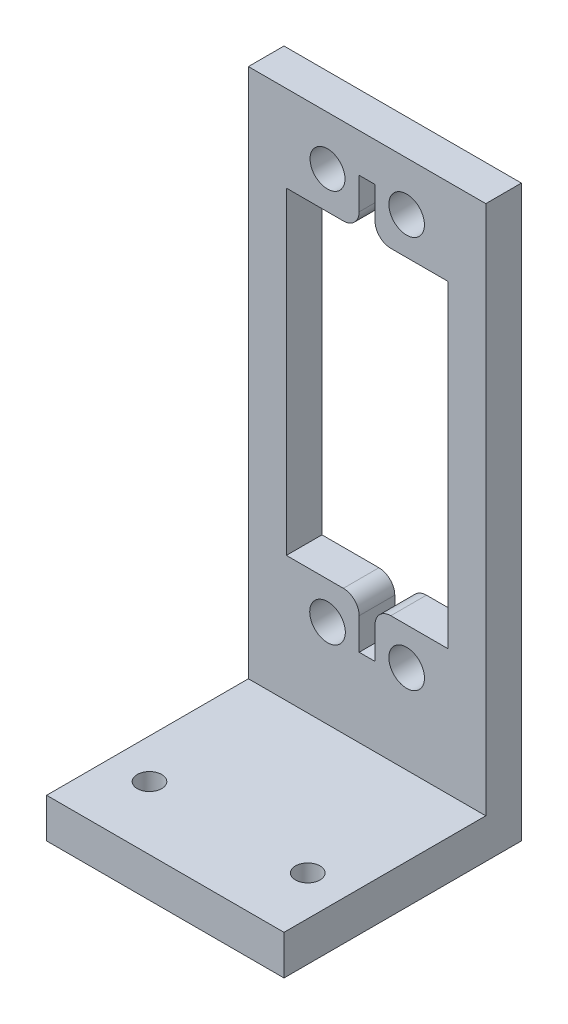
from build123d import *

# Parameters (mm, degrees)
SKETCH_1_W          = 30
SKETCH_1_H          = 62
SKETCH_1_W_2        = 20.4
SKETCH_1_H_2        = 40.2
EXTRUDE_1_DEPTH     = 4.5
SKETCH_3_R          = 2.25
SKETCH_3_R_2        = 2.20649786
CUT_EXTRUDE_1_DEPTH = 35.731109974
SKETCH_5_W          = 30
SKETCH_5_H          = 4.5
EXTRUDE_3_DEPTH     = 5
SKETCH_6_W          = 30
SKETCH_6_H          = 30
EXTRUDE_4_DEPTH     = 5
SKETCH_7_R          = 1.55
CUT_EXTRUDE_2_DEPTH = 80.429213769
SKETCH_8_W          = 2
SKETCH_8_H          = 6
CUT_EXTRUDE_3_DEPTH = 51.55937104
FILLET_1_R          = 2


with BuildPart() as part:
    # 草图1 → 凸台-拉伸1 (new body)
    with BuildSketch(Plane.XY):
        Rectangle(SKETCH_1_W, SKETCH_1_H)
        Rectangle(SKETCH_1_W_2, SKETCH_1_H_2, mode=Mode.SUBTRACT)
    extrude(amount=EXTRUDE_1_DEPTH)

    # 草图3 → 切除-拉伸1 (cut, through all)
    with BuildSketch(Plane(origin=(0, 0, 0), x_dir=(-1, 0, 0), z_dir=(0, 0, -1))):
        with Locations((-5, -24.8)):
            Circle(SKETCH_3_R)
        with Locations((5, -24.8)):
            Circle(SKETCH_3_R)
        with Locations((-5, 24.8)):
            Circle(SKETCH_3_R)
        with Locations((5, 24.8)):
            Circle(SKETCH_3_R_2)
    extrude(amount=-CUT_EXTRUDE_1_DEPTH, mode=Mode.SUBTRACT)

    # 草图5 → 凸台-拉伸3 (add)
    with BuildSketch(Plane.XZ.offset(31)):
        with Locations((0, 2.25)):
            Rectangle(SKETCH_5_W, SKETCH_5_H)
    extrude(amount=EXTRUDE_3_DEPTH)

    # 草图6 → 凸台-拉伸4 (add)
    with BuildSketch(Plane.XZ.offset(36)):
        with Locations((0, 15)):
            Rectangle(SKETCH_6_W, SKETCH_6_H)
    extrude(amount=EXTRUDE_4_DEPTH)

    # 草图7 → 切除-拉伸2 (cut, through all)
    with BuildSketch(Plane.XZ.offset(41)):
        with Locations((10, 22)):
            Circle(SKETCH_7_R)
        with Locations((-10, 22)):
            Circle(SKETCH_7_R)
    extrude(amount=-CUT_EXTRUDE_2_DEPTH, mode=Mode.SUBTRACT)

    # 草图8 → 切除-拉伸3 (cut, through all)
    with BuildSketch(Plane.XY.offset(4.5)):
        with Locations((0, -23.1)):
            Rectangle(SKETCH_8_W, SKETCH_8_H)
        with Locations((0, 23.1)):
            Rectangle(SKETCH_8_W, SKETCH_8_H)
    extrude(amount=-CUT_EXTRUDE_3_DEPTH, mode=Mode.SUBTRACT)

    # 圆角1
    fillet_1_edges = [part.edges().sort_by_distance(p)[0] for p in [
        (1, 20.1, 2.25),
        (-1, 20.1, 2.25),
        (1, -20.1, 2.25),
        (-1, -20.1, 2.25),
    ]]
    fillet(fillet_1_edges, radius=FILLET_1_R)


solid = part.part
